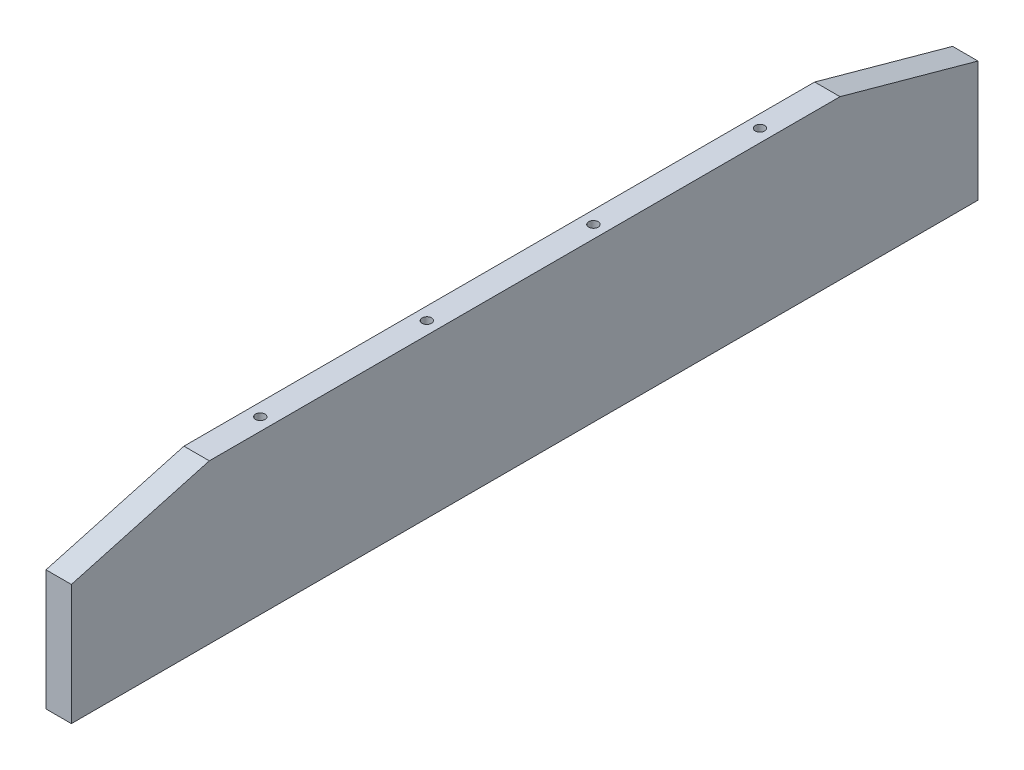
from build123d import *

# Parameters (mm, degrees)
BOSS_EXTRUDE1_DEPTH = 8
SKETCH6_R           = 1.5
CUT_EXTRUDE2_DEPTH  = 50


with BuildPart() as part:
    # Sketch1 → Boss-Extrude1 (new body)
    with BuildSketch(Plane(origin=(0, 0, 0), x_dir=(0, 0, -1), z_dir=(1, 0, 0))):
        Polygon((-37.279, 0), (248.465, 0), (248.465, 37.995251441), (204.990822019, 50), (6.195177981, 50), (-37.279, 37.995251441), align=None)
    extrude(amount=BOSS_EXTRUDE1_DEPTH)

    # Sketch6 → Cut-Extrude2 (cut)
    with BuildSketch(Plane.XZ):
        with Locations((4, -26.25)):
            Circle(SKETCH6_R)
        with Locations((4, -78.75)):
            Circle(SKETCH6_R)
        with Locations((4, -131.25)):
            Circle(SKETCH6_R)
        with Locations((4, -183.75)):
            Circle(SKETCH6_R)
    extrude(amount=-CUT_EXTRUDE2_DEPTH, mode=Mode.SUBTRACT)


solid = part.part
